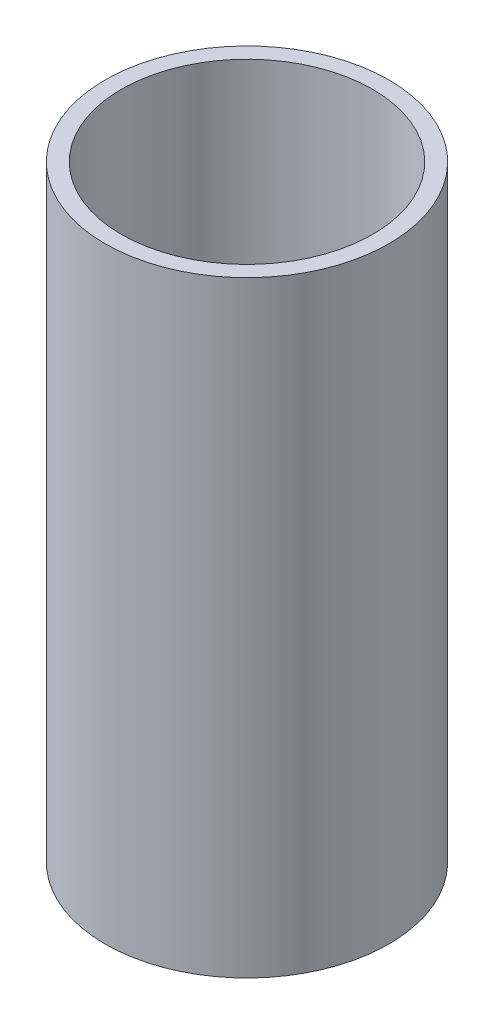
from build123d import *

# Parameters (mm, degrees)
SKETCH1_R           = 30
BOSS_EXTRUDE1_DEPTH = 128.235622742
SKETCH2_R           = 26.574125281
CUT_EXTRUDE1_DEPTH  = 136.071739975


with BuildPart() as part:
    # Sketch1 → Boss-Extrude1 (new body)
    with BuildSketch(Plane(origin=(0, 0, 0), x_dir=(1, 0, 0), z_dir=(0, 1, 0))):
        Circle(SKETCH1_R)
    extrude(amount=BOSS_EXTRUDE1_DEPTH)

    # Sketch2 → Cut-Extrude1 (cut, through all)
    with BuildSketch(Plane(origin=(0, 0, 0), x_dir=(1, 0, 0), z_dir=(0, 1, 0))):
        Circle(SKETCH2_R)
    extrude(amount=CUT_EXTRUDE1_DEPTH, mode=Mode.SUBTRACT)


solid = part.part
